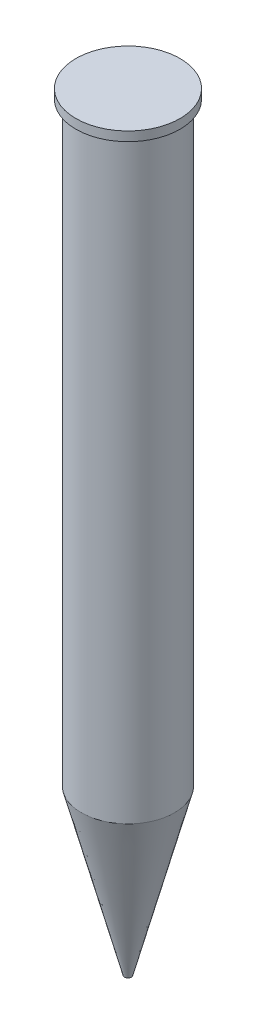
from build123d import *

# Parameters (mm, degrees)
SKETCH1_R           = 63.5
BOSS_EXTRUDE1_DEPTH = 812.8
SKETCH2_R           = 71.128555951
BOSS_EXTRUDE2_DEPTH = 12.7


with BuildPart() as part:
    # Sketch1 → Boss-Extrude1 (new body)
    with BuildSketch(Plane(origin=(0, 0, 0), x_dir=(1, 0, 0), z_dir=(0, 1, 0))):
        Circle(SKETCH1_R)
    extrude(amount=BOSS_EXTRUDE1_DEPTH)

    # Sketch2 → Boss-Extrude2 (add)
    with BuildSketch(Plane(origin=(0, 812.8, 0), x_dir=(1, 0, 0), z_dir=(0, 1, 0))):
        Circle(SKETCH2_R)
    extrude(amount=BOSS_EXTRUDE2_DEPTH)

    # Sketch5 → Revolve2 (revolve)
    with BuildSketch(Plane(origin=(0, 0, 0), x_dir=(0, 0, -1), z_dir=(1, 0, 0))):
        Polygon((-63.5, 0), (0, 0), (0, -223.940998137), (-4.689426477, -223.940998137), align=None)
    revolve(axis=Axis((0, 0, 0), (0, -1, 0)))


solid = part.part
